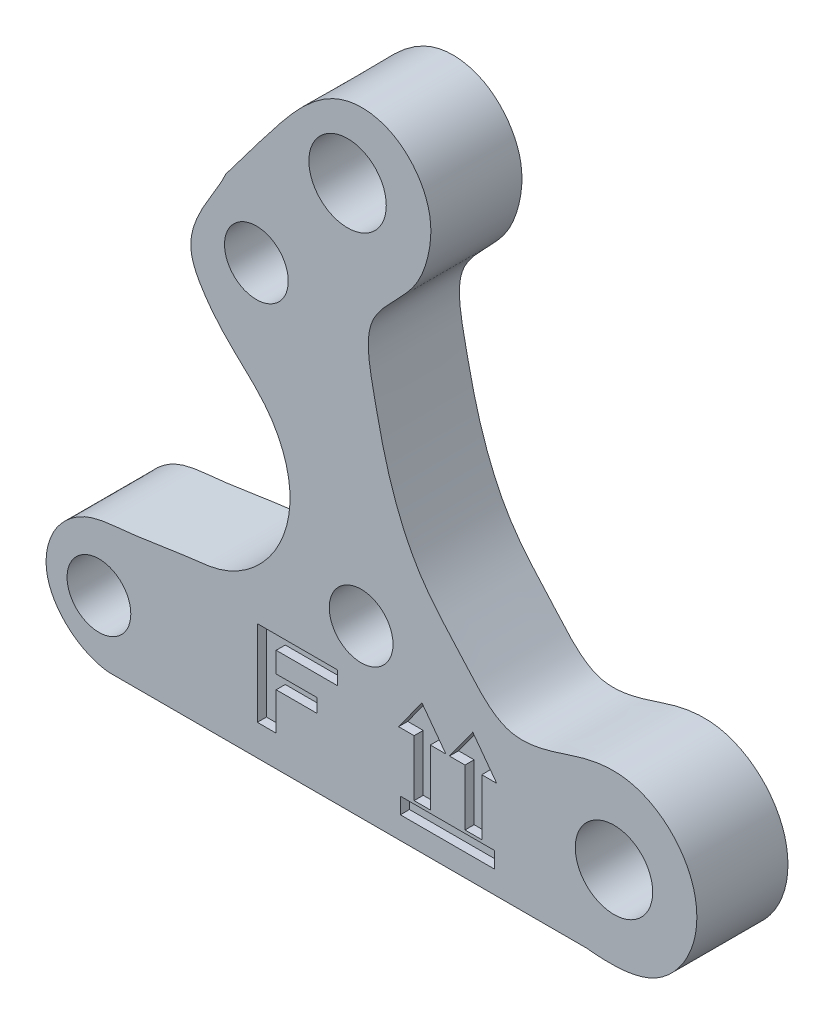
from build123d import *

# Parameters (mm, degrees)
MODEL_R            = 1.75
MODEL_R_2          = 4.25
MAIN_BODY_DEPTH    = 10
MODEL_5_W          = 10.315123612
MODEL_5_H          = 1.773937843
SYMBOLS_DEPTH      = 1
MODEL_6_R          = 3.5
MODEL_6_R_2        = 1.75
RECESS_HOLES_DEPTH = 6


with BuildPart() as part:
    # Model → Main body (new body)
    with BuildSketch(Plane.XY):
        with BuildLine():
            Line((22.086789496, -27.798245314), (-30.374196976, -27.798245314))
            add(Edge.make_bspline(
                [(-17.538442516, 26.004081512), (-18.538297116, 23.605862033), (-22.906581963, 18.754059646), (-19.989793116, 13.373218867), (-17.018344154, 9.682388722), (-12.197050491, 5.986089091), (-9.673365897, -1.214004586), (-12.056188368, -8.347550444), (-17.110409271, -12.077698709), (-21.535008402, -12.428733663), (-24.918043379, -12.97629583), (-28.588757867, -13.51709323), (-32.953232047, -13.794755273), (-36.740356431, -16.830503628), (-38.189116389, -23.616785026), (-33.487184883, -27.52082329), (-30.374196976, -27.798245314)],
                knots=[0, 0, 0, 0, 0.128042389, 0.173454018, 0.219153052, 0.309797418, 0.399283263, 0.488821231, 0.578316984, 0.618188783, 0.656226873, 0.708611844, 0.759756085, 0.819423474, 0.878794788, 1, 1, 1, 1], degree=3))
            Line((-17.538442516, 26.004081512), (-13.872151512, 30.861285205))
            add(Edge.make_bspline(
                [(-13.872151512, 30.861285205), (-11.242855817, 34.137806076), (-7.150043663, 40.520160255), (1.562226031, 39.416373843), (5.345947757, 34.558765511), (4.868367052, 29.271667753), (2.869518079, 24.35389753), (-2.770333758, 20.70690297), (-1.192098482, 12.663100042), (0.333796067, 5.604126508), (3.553312262, -1.873717532), (8.438966414, -6.929348048), (12.700727629, -12.107536515), (18.019400725, -11.221948452), (21.880721708, -9.6806106), (26.236071232, -9.168544501), (30.750432493, -10.993531334), (34.124404593, -15.30441135), (34.521705172, -21.816592139), (29.939692895, -28.16515456), (24.448344054, -28.045567403), (22.086789496, -27.798245314)],
                knots=[0, 0, 0, 0, 0.113776739, 0.147277569, 0.205992163, 0.245682974, 0.27549376, 0.337831538, 0.391118238, 0.45976214, 0.525989659, 0.587795398, 0.640878991, 0.676386947, 0.71189988, 0.747233078, 0.782556716, 0.829334419, 0.876113873, 0.937740926, 1, 1, 1, 1], degree=3))
        make_face()
        with Locations((-31.472318321, -21.04742708)):
            Circle(MODEL_R, mode=Mode.SUBTRACT)
        with Locations((25.07640309, -18.84923931)):
            Circle(MODEL_R_2, mode=Mode.SUBTRACT)
        with Locations((-4.173596907, 31.813246811)):
            Circle(MODEL_R_2, mode=Mode.SUBTRACT)
        with Locations((-14.186209652, 19.241410668)):
            Circle(MODEL_R, mode=Mode.SUBTRACT)
        with Locations((-2.684845112, -9.54606254)):
            Circle(MODEL_R, mode=Mode.SUBTRACT)
    extrude(amount=-MAIN_BODY_DEPTH)

    # Model<5> → Symbols (cut)
    with BuildSketch(Plane.XY):
        Polygon((-14.078876314, -24.403385612), (-12.013974634, -24.403385612), (-12.013974634, -20.273582251), (-7.508734034, -20.273582251), (-7.508734034, -18.771835086), (-12.013974634, -18.771835086), (-12.013974634, -16.519215234), (-5.256113735, -16.519215234), (-5.256113735, -15.017468069), (-14.078876314, -15.017468069), align=None)
        with Locations((6.781325559, -24.455008445)):
            Rectangle(MODEL_5_W, MODEL_5_H)
        Polygon((1.426659449, -17.06359838), (3.134896379, -17.06359838), (3.134896379, -23.239532051), (4.908834893, -23.239532051), (4.908834893, -17.06359838), (6.617072047, -17.06359838), (3.989014956, -13.515720904), align=None)
        Polygon((7.011280208, -17.06359838), (8.719517362, -17.06359838), (8.719517362, -23.239532051), (10.559157236, -23.239532051), (10.559157236, -17.06359838), (12.201692806, -17.06359838), (9.573635715, -13.515720904), align=None)
    extrude(amount=-SYMBOLS_DEPTH, mode=Mode.SUBTRACT)

    # Model<6> → Recess holes (cut)
    # profile 1 of 3: a face of its own
    with BuildSketch(Plane.XY):
        with Locations((-31.472318321, -21.04742708)):
            Circle(MODEL_6_R)
        with Locations((-31.472318321, -21.04742708)):
            Circle(MODEL_6_R_2, mode=Mode.SUBTRACT)
    # profile 2 of 3: a face of its own
    with BuildSketch(Plane.XY):
        with Locations((-14.186209652, 19.241410668)):
            Circle(MODEL_6_R)
        with Locations((-14.186209652, 19.241410668)):
            Circle(MODEL_6_R_2, mode=Mode.SUBTRACT)
    # profile 3 of 3: a face of its own
    with BuildSketch(Plane.XY):
        with Locations((-2.684845112, -9.54606254)):
            Circle(MODEL_6_R)
        with Locations((-2.684845112, -9.54606254)):
            Circle(MODEL_6_R_2, mode=Mode.SUBTRACT)
    extrude(amount=-RECESS_HOLES_DEPTH, mode=Mode.SUBTRACT)


solid = part.part
